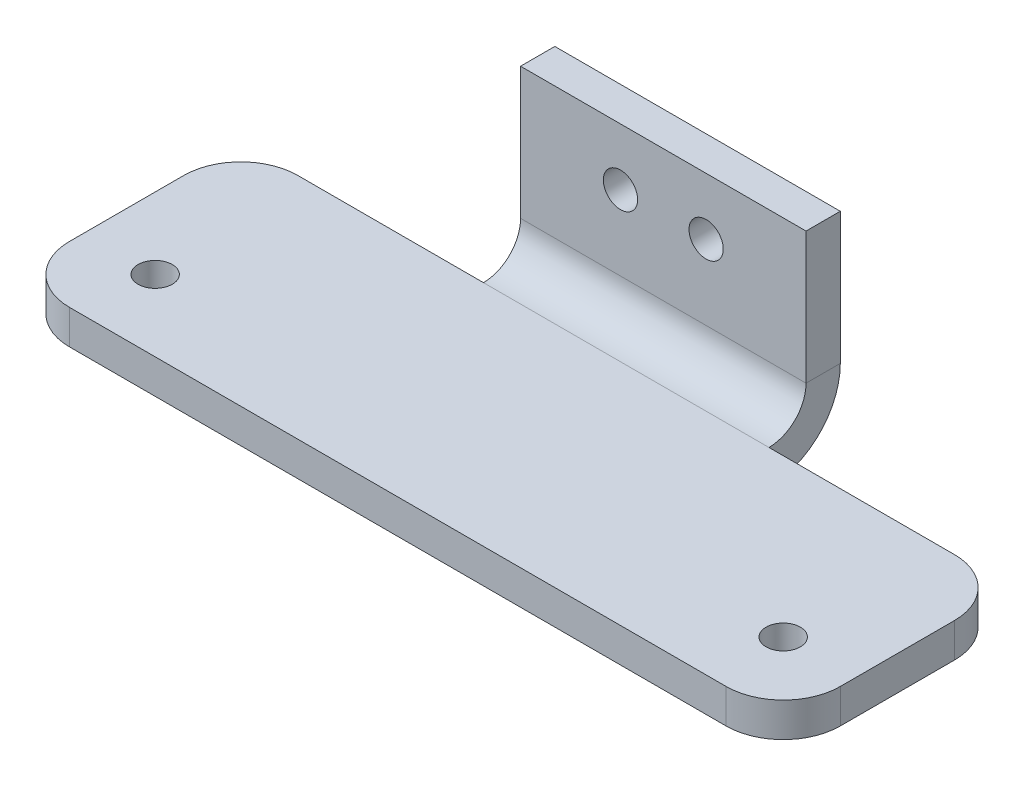
from build123d import *

# Parameters (mm, degrees)
BASE_FLANGE1_DEPTH     = 6
SKETCHED_START         = -25
SKETCHED_BEND1_DEPTH   = 50
SKETCHED_BEND1_2_DEPTH = 50
SKETCH8_R              = 3
CUT_EXTRUDE1_DEPTH     = 81.54392997
FILLET1_R              = 10
SKETCH10_R             = 3
CUT_EXTRUDE2_DEPTH     = 88.139684731


# Read off the part's stored shape, not the designer's step: Sketched Bend1
# Sheet-metal steps are written as plain solids
with BuildPart() as part:
    # Sketch1 → Base-Flange1 (new body)
    with BuildSketch(Plane(origin=(0, 0, 0), x_dir=(1, 0, 0), z_dir=(0, 1, 0))):
        Polygon((25, 20), (67.5, 20), (67.5, -20), (-67.5, -20), (-67.5, 20), (-25, 20), (-25, 58), (25, 58), align=None)
    extrude(amount=-BASE_FLANGE1_DEPTH)

    # Sketched Bend1 outline → Sketched Bend1 (cut)
    with BuildSketch(Plane.YZ.offset(SKETCHED_START)):
        with BuildLine():
            Line((0, -58), (0, -30.677078252))
            ThreePointArc((0, -30.677078252), (-4.397247359, -26.123724357), (-6, -20))
            Line((-6, -20), (-6, -58))
            Line((-6, -58), (0, -58))
        make_face()
    extrude(amount=SKETCHED_BEND1_DEPTH, mode=Mode.SUBTRACT)

    # Sketched Bend1 2 outline → Sketched Bend1 2 (add)
    with BuildSketch(Plane.YZ.offset(SKETCHED_START)):
        with BuildLine():
            Line((6.5, -32.5), (29.577434895, -32.5))
            Line((29.577434895, -32.5), (29.577434895, -26.5))
            Line((29.577434895, -26.5), (6.5, -26.5))
            ThreePointArc((6.5, -26.5), (1.903805922, -24.596194078), (0, -20))
            Line((0, -20), (0, -30.677078252))
            ThreePointArc((0, -30.677078252), (3.124609515, -32.035644523), (6.5, -32.5))
        make_face()
    extrude(amount=SKETCHED_BEND1_2_DEPTH)

    # Sketch8 → Cut-Extrude1 (cut, through all)
    with BuildSketch(Plane(origin=(0, 0, 0), x_dir=(1, 0, 0), z_dir=(0, 1, 0))):
        with Locations(Location((-55, -7.5, 0), (0, 0, 270))):
            Circle(SKETCH8_R)
        with Locations(Location((55, -7.5, 0), (0, 0, 90))):
            Circle(SKETCH8_R)
    extrude(amount=-CUT_EXTRUDE1_DEPTH, mode=Mode.SUBTRACT)

    # Fillet1
    fillet1_edges = [part.edges().sort_by_distance(p)[0] for p in [
        (-67.5, -3, 20),
        (67.5, -3, 20),
        (67.5, -3, -20),
        (-67.5, -3, -20),
    ]]
    fillet(fillet1_edges, radius=FILLET1_R)

    # Sketch10 → Cut-Extrude2 (cut, through all)
    with BuildSketch(Plane.XY.offset(-26.5)):
        with Locations((-7.5, 19.577434895)):
            Circle(SKETCH10_R)
        with Locations(Location((7.5, 19.577434895, 0), (0, 0, 180))):
            Circle(SKETCH10_R)
    extrude(amount=-CUT_EXTRUDE2_DEPTH, mode=Mode.SUBTRACT)


solid = part.part
